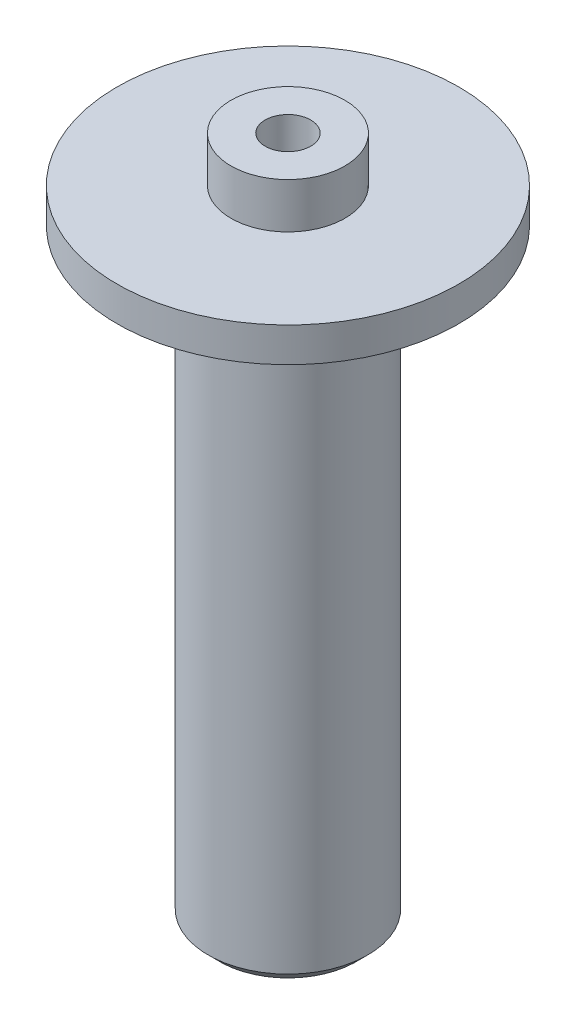
from build123d import *

# Parameters (mm, degrees)
CHAMFER_1_SIZE = 1


with BuildPart() as part:
    # Эскиз1 → Повернуть1 (revolve)
    with BuildSketch(Plane.XY):
        Polygon((2, 0), (2, 60), (5, 60), (5, 56.015893334), (15, 56.015893334), (15, 52.994307373), (7, 52.994307373), (7, 0), align=None)
    revolve(axis=Axis((0, -11.441390283, 0), (0, 1, 0)))

    # Фаска1
    chamfer_1_edges = [part.edges().sort_by_distance(p)[0] for p in [
        (-7, 0, 0),
    ]]
    chamfer(chamfer_1_edges, length=CHAMFER_1_SIZE)


solid = part.part
